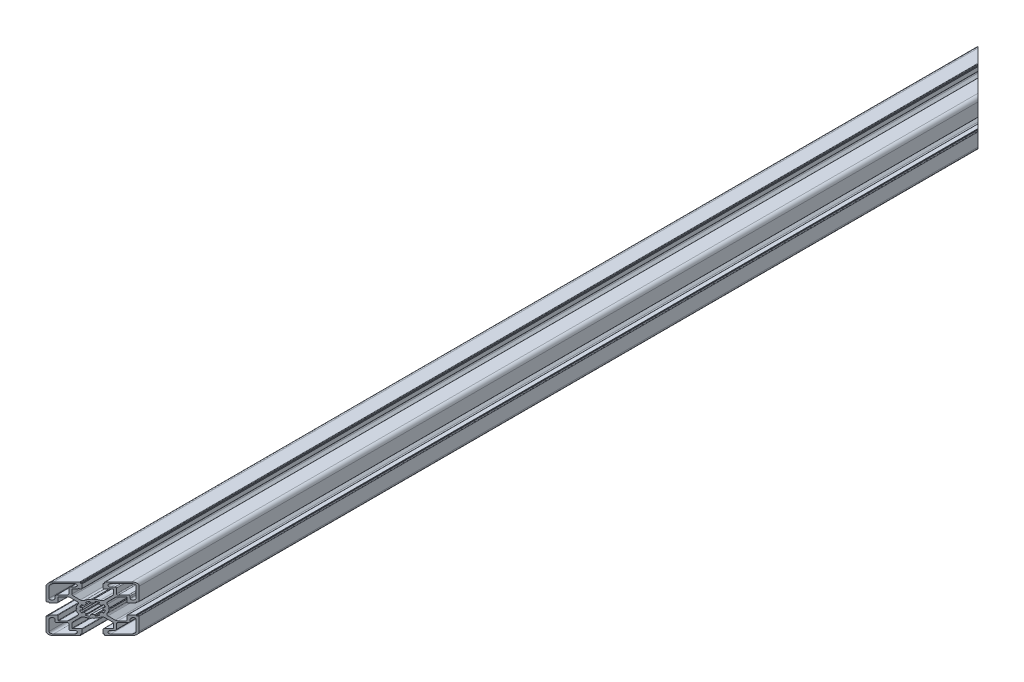
from build123d import *

# Parameters (mm, degrees)
BOSS_EXTRUDE1_DEPTH      = 1524
FILLET4_R                = 1.885
FILLET5_R                = 0.377
DELETEFACE1_START        = -1524
DELETEFACE1_DEPTH        = 3048
CUT_EXTRUDE1_DEPTH       = 1525.332148844
CIRPATTERN2_COUNT        = 3
CIRPATTERN2_ANGLE        = 180
FILLET2_R                = 0.377
FILLET3_R                = 0.1885
CUT_EXTRUDE2_DEPTH       = 3049.166087995
CUT_EXTRUDE2_DEPTH_BACK  = 3049.166087995
SKETCH5_R                = 6.375
BOSS_EXTRUDE2_DEPTH      = 1524
FILLET6_R                = 0.377
CIRPATTERN1_COUNT        = 8
FILLET6_OF_CIRPATTERN1_R = 0.377
CUT_EXTRUDE3_DEPTH       = 1525.332148844
CUT_EXTRUDE3_DEPTH_BACK  = 1525.332148844
SKETCH8_W                = 52.183051874
SKETCH8_H                = 48.654042822
CUT_EXTRUDE4_DEPTH       = 2148
CUT_EXTRUDE5_DEPTH       = 2148


# Read off the part's stored shape, not the designer's step: DeleteFace1
with BuildPart() as part:
    # Sketch3 → Boss-Extrude1 (new, symmetric)
    with BuildSketch(Plane.XY):
        with BuildLine():
            Line((0, -8), (0, -5))
            ThreePointArc((0, -5), (3.535533906, -3.535533906), (5, 0))
            Line((5, 0), (8, 0))
            ThreePointArc((8, 0), (7.57237156, -2.58054044), (6.335202759, -4.885202759))
            Line((6.335202759, -4.885202759), (11.5, -10.05))
            Line((11.5, -10.05), (16.7, -10.05))
            Line((16.7, -10.05), (16.7, -5))
            Line((16.7, -5), (21.05, -5))
            Line((21.05, -5), (21.05, 0))
            Line((21.05, 0), (22.5, 0))
            Line((22.5, 0), (22.5, -18.875))
            ThreePointArc((22.5, -18.875), (21.438262082, -21.438262082), (18.875, -22.5))
            Line((18.875, -22.5), (0, -22.5))
            Line((0, -22.5), (0, -21.05))
            Line((0, -21.05), (5, -21.05))
            Line((5, -21.05), (5, -16.7))
            Line((5, -16.7), (10.05, -16.7))
            Line((10.05, -16.7), (10.05, -11.5))
            Line((10.05, -11.5), (4.885202759, -6.335202759))
            ThreePointArc((4.885202759, -6.335202759), (2.58054044, -7.57237156), (0, -8))
        make_face()
        with BuildLine():
            Line((18.15, -8.79375), (18.15, -10.5575))
            ThreePointArc((18.15, -10.5575), (17.873948141, -11.223948141), (17.2075, -11.5))
            Line((17.2075, -11.5), (12.4425, -11.5))
            ThreePointArc((12.4425, -11.5), (11.776051859, -11.776051859), (11.5, -12.4425))
            Line((11.5, -12.4425), (11.5, -17.2075))
            ThreePointArc((11.5, -17.2075), (11.223948141, -17.873948141), (10.5575, -18.15))
            Line((10.5575, -18.15), (8.79375, -18.15))
            ThreePointArc((8.79375, -18.15), (7.34375, -19.6), (8.79375, -21.05))
            Line((8.79375, -21.05), (18.875, -21.05))
            ThreePointArc((18.875, -21.05), (20.412957249, -20.412957249), (21.05, -18.875))
            Line((21.05, -18.875), (21.05, -8.79375))
            ThreePointArc((21.05, -8.79375), (19.6, -7.34375), (18.15, -8.79375))
        make_face(mode=Mode.SUBTRACT)
    extrude(amount=BOSS_EXTRUDE1_DEPTH, both=True)

    # Fillet4
    fillet4_edges = [part.edges().sort_by_distance(p)[0] for p in [
        (10.05, -11.5, 0),
        (4.885202759, -6.335202759, 0),
        (6.335202759, -4.885202759, 0),
        (11.5, -10.05, 0),
    ]]
    fillet(fillet4_edges, radius=FILLET4_R)

    # Fillet5
    fillet5_edges = [part.edges().sort_by_distance(p)[0] for p in [
        (5, -21.05, 0),
        (5, -16.7, 0),
        (10.05, -16.7, 0),
        (16.7, -10.05, 0),
        (16.7, -5, 0),
        (21.05, -5, 0),
    ]]
    fillet(fillet5_edges, radius=FILLET5_R)

    # Mirror1: part across plane


with BuildPart() as part_1:
    add(part.part)
    add(part.part.mirror(Plane.ZX))

    # DeleteFace1 outline → DeleteFace1 (cut)
    with BuildSketch(Plane.XY.offset(DELETEFACE1_START)):
        with BuildLine():
            ThreePointArc((4.623, 21.05), (4.889579257, 20.939579257), (5, 20.673))
            Line((5, 20.673), (5, 21.05))
            Line((5, 21.05), (4.623, 21.05))
        make_face()
    extrude(amount=DELETEFACE1_DEPTH, mode=Mode.SUBTRACT)

    # Sketch4 → Cut-Extrude1 (cut, symmetric)
    with BuildSketch(Plane.XY):
        Polygon((5.85, 21.05), (5.85, 22.5), (0, 22.5), (-5.85, 22.5), (-5.85, 21.05), (-5, 21.05), (-5, 16.7), (5, 16.7), (5, 21.05), align=None)
    cut_extrude1 = extrude(amount=CUT_EXTRUDE1_DEPTH, both=True, mode=Mode.SUBTRACT)

    # CirPattern2: Cut-Extrude1 ×3 about axis
    cirpattern2_axis = Axis((0, 0, 1489), (0, 0, -1))
    for i in range(1, CIRPATTERN2_COUNT):
        add(cut_extrude1.rotate(cirpattern2_axis, i * CIRPATTERN2_ANGLE / (CIRPATTERN2_COUNT - 1)), mode=Mode.SUBTRACT)

    # Fillet2
    fillet2_edges = [part_1.edges().sort_by_distance(p)[0] for p in [
        (5.85, 22.5, 0),
        (22.5, 5.85, 0),
        (22.5, -5.85, 0),
        (5.85, -22.5, 0),
    ]]
    fillet(fillet2_edges, radius=FILLET2_R)

    # Fillet3
    fillet3_edges = [part_1.edges().sort_by_distance(p)[0] for p in [
        (5, 21.05, 0),
        (5.85, 21.05, 0),
        (21.05, -5, 0),
        (21.05, -5.85, 0),
        (21.05, 5, 0),
        (21.05, 5.85, 0),
        (5, -21.05, 0),
        (5.85, -21.05, 0),
    ]]
    fillet(fillet3_edges, radius=FILLET3_R)

    # Mirror2: part across plane


with BuildPart() as part_2:
    add(part_1.part)
    add(part_1.part.mirror(Plane(origin=(0, 0, 0), x_dir=(0, 0, 1), z_dir=(1, 0, 0))))

    # Sketch5 → Cut-Extrude2 (cut, two sides: drawn at the far end of the back side and taken through both)
    with BuildSketch(Plane.XY.offset(1524).offset(-CUT_EXTRUDE2_DEPTH_BACK)):
        Circle(SKETCH5_R)
        Polygon((-0.580185128, 8), (0.580185128, 8), (0, 7.59375), align=None)
        Polygon((-8, 0.580185128), (-8, -0.580185128), (-7.59375, 0), align=None)
        Polygon((8, 0.580185128), (8, -0.580185128), (7.59375, 0), align=None)
        Polygon((-0.580185128, -8), (0.580185128, -8), (0, -7.59375), align=None)
    extrude(amount=CUT_EXTRUDE2_DEPTH + CUT_EXTRUDE2_DEPTH_BACK, mode=Mode.SUBTRACT)

    # Sketch6 → Boss-Extrude2 (add, symmetric)
    with BuildSketch(Plane.XY):
        with BuildLine():
            Line((-0.97545161, -4.903926402), (-1.243700803, -6.252506163))
            ThreePointArc((-1.243700803, -6.252506163), (0, -6.375), (1.243700803, -6.252506163))
            Line((1.243700803, -6.252506163), (0.97545161, -4.903926402))
            ThreePointArc((0.97545161, -4.903926402), (0, -5), (-0.97545161, -4.903926402))
        make_face()
    boss_extrude2 = extrude(amount=BOSS_EXTRUDE2_DEPTH, both=True)

    # Fillet6
    fillet6_edges = [part_2.edges().sort_by_distance(p)[0] for p in [
        (-1.243700803, -6.252506163, 0),
        (1.243700803, -6.252506163, 0),
    ]]
    fillet(fillet6_edges, radius=FILLET6_R)

    # CirPattern1: Boss-Extrude2 ×8 about axis
    cirpattern1_axis = Axis((0, 0, 0), (0, 0, 1))
    for i in range(1, CIRPATTERN1_COUNT):
        add(boss_extrude2.rotate(cirpattern1_axis, i * 360 / CIRPATTERN1_COUNT))

    # Fillet6 of CirPattern1
    fillet6_of_cirpattern1_edges = [part_2.edges().sort_by_distance(p)[0] for p in [
        (3.541760235, -5.300618778, 0),
        (5.300618778, -3.541760235, 0),
        (6.252506163, -1.243700803, 0),
        (6.252506163, 1.243700803, 0),
        (5.300618778, 3.541760235, 0),
        (3.541760235, 5.300618778, 0),
        (1.243700803, 6.252506163, 0),
        (-1.243700803, 6.252506163, 0),
        (-3.541760235, 5.300618778, 0),
        (-5.300618778, 3.541760235, 0),
        (-6.252506163, 1.243700803, 0),
        (-6.252506163, -1.243700803, 0),
        (-5.300618778, -3.541760235, 0),
        (-3.541760235, -5.300618778, 0),
    ]]
    fillet(fillet6_of_cirpattern1_edges, radius=FILLET6_OF_CIRPATTERN1_R)

    # Sketch7 → Cut-Extrude3 (cut, two sides: drawn at the far end of the back side and taken through both)
    with BuildSketch(Plane.XY.offset(-CUT_EXTRUDE3_DEPTH_BACK)):
        Polygon((-7.031875, 16.7), (-6.596875, 17.135), (-6.161875, 16.7), align=None)
    extrude(amount=CUT_EXTRUDE3_DEPTH + CUT_EXTRUDE3_DEPTH_BACK, mode=Mode.SUBTRACT)

    # Sketch8 → Cut-Extrude4 (cut)
    with BuildSketch(Plane.XY.offset(1524)):
        Rectangle(SKETCH8_W, SKETCH8_H)
    extrude(amount=-CUT_EXTRUDE4_DEPTH, mode=Mode.SUBTRACT)

    # Sketch9 → Cut-Extrude5 (cut)
    with BuildSketch(Plane(origin=(0, 22.5, 0), x_dir=(1, 0, 0), z_dir=(0, 1, 0))):
        Polygon((-22.5, 624), (22.5, 669), (22.5, 624), align=None)
        Polygon((-22.5, 1524), (22.5, 1524), (22.5, 1479), align=None)
    extrude(amount=-CUT_EXTRUDE5_DEPTH, mode=Mode.SUBTRACT)


solid = part_2.part
